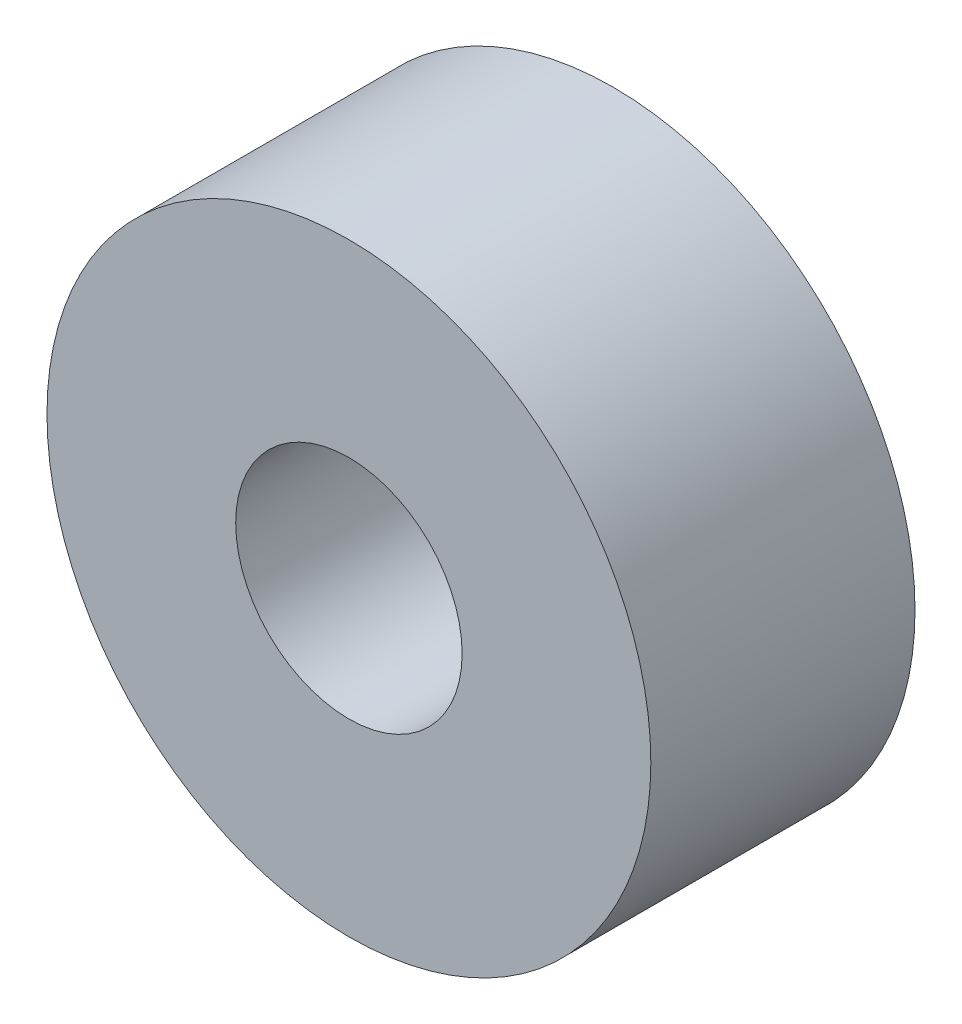
from build123d import *

# Parameters (mm, degrees)
SKETCH_1_R      = 4
SKETCH_1_R_2    = 1.5
EXTRUDE_1_DEPTH = 3.5


with BuildPart() as part:
    # 草图1 → 凸台-拉伸1 (new body)
    with BuildSketch(Plane.XY):
        Circle(SKETCH_1_R)
        Circle(SKETCH_1_R_2, mode=Mode.SUBTRACT)
    extrude(amount=EXTRUDE_1_DEPTH)


solid = part.part
